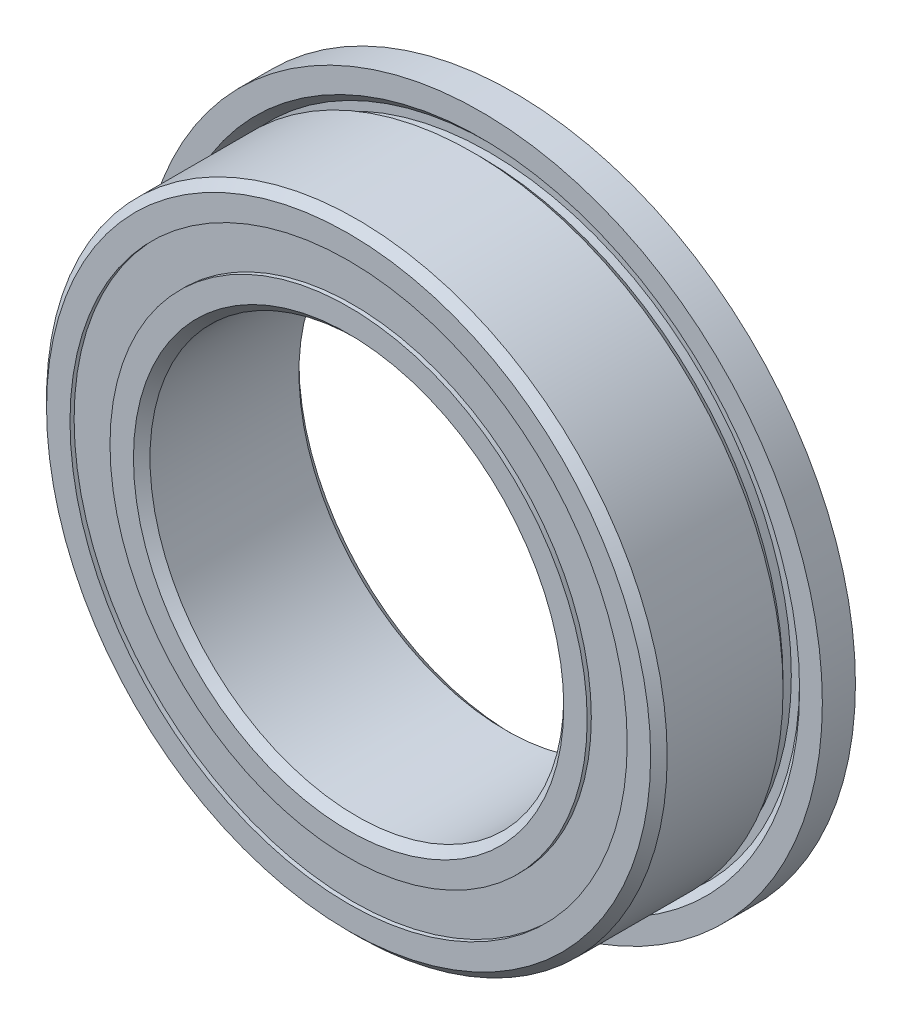
from build123d import *

# Parameters (mm, degrees)
SKETCH6_W         = 0.161172162
SKETCH6_H         = 0.483516484
CIRPATTERN1_COUNT = 11
SKETCH5_W         = 0.888114806
SKETCH5_H         = 0.967032968


with BuildPart() as part:
    # Sketch7 → Revolve7 (revolve)
    with BuildSketch(Plane(origin=(0, 0, 0), x_dir=(0, 0, -1), z_dir=(1, 0, 0))):
        with BuildLine():
            Line((2, 8.25), (1.2, 8.25))
            Line((1.2, 8.25), (1.2, 7.7))
            Line((1.2, 7.7), (1.4, 7.5))
            Line((1.4, 7.5), (1.4, 7.3))
            Line((1.4, 7.3), (1.2, 7.3))
            Line((1.2, 7.3), (1, 7.5))
            Line((1, 7.5), (-1.8, 7.5))
            Line((-1.8, 7.5), (-2, 7.3))
            Line((-2, 7.3), (-2, 6.733516484))
            Line((-2, 6.733516484), (-0.888888889, 6.733516484))
            ThreePointArc((-0.888888889, 6.733516484), (0, 7.261885194), (0.888888889, 6.733516484))
            Line((0.888888889, 6.733516484), (2, 6.733516484))
            Line((2, 6.733516484), (2, 7.3))
            Line((2, 7.3), (2, 8.25))
        make_face()
    revolve(axis=Axis((0, 0, 2), (0, 0, -1)))


with BuildPart() as body_2:
    # Sketch3 → Revolve3 (revolve)
    with BuildSketch(Plane(origin=(0, 0, 0), x_dir=(0, 0, -1), z_dir=(1, 0, 0))):
        with BuildLine():
            Line((-2, 5.766483516), (-0.888888889, 5.766483516))
            ThreePointArc((-0.888888889, 5.766483516), (0, 5.238114806), (0.888888889, 5.766483516))
            Line((0.888888889, 5.766483516), (2, 5.766483516))
            Line((2, 5.766483516), (2, 5.2))
            Line((2, 5.2), (1.8, 5))
            Line((1.8, 5), (-1.8, 5))
            Line((-1.8, 5), (-2, 5.2))
            Line((-2, 5.2), (-2, 5.766483516))
        make_face()
    revolve(axis=Axis((0, 0, 2), (0, 0, -1)))


with BuildPart() as body_3:
    # Sketch6 → Revolve6 (revolve)
    with BuildSketch(Plane(origin=(0, 0, 0), x_dir=(0, 0, -1), z_dir=(1, 0, 0))):
        with Locations((0, 6.25)):
            Rectangle(SKETCH6_W, SKETCH6_H)
    revolve(axis=Axis((0, 0, 2), (0, 0, -1)))


with BuildPart() as body_4:
    # Sketch4 → Revolve4 (revolve)
    with BuildSketch(Plane(origin=(0, 0, 0), x_dir=(0, 0, -1), z_dir=(1, 0, 0))):
        with BuildLine():
            Line((-1.011885194, 6.25), (1.011885194, 6.25))
            ThreePointArc((1.011885194, 6.25), (0, 7.261885194), (-1.011885194, 6.25))
        make_face()
    revolve(axis=Axis((0, 6.25, 1.011885194), (0, 0, -1)))


with BuildPart() as cirpattern1_1:
    # CirPattern1: pattern copy
    add(body_4.part.rotate(Axis((0, 0, -2), (0, 0, 1)), 1 * 360 / CIRPATTERN1_COUNT))


with BuildPart() as cirpattern1_2:
    # CirPattern1: pattern copy
    add(body_4.part.rotate(Axis((0, 0, -2), (0, 0, 1)), 2 * 360 / CIRPATTERN1_COUNT))


with BuildPart() as cirpattern1_3:
    # CirPattern1: pattern copy
    add(body_4.part.rotate(Axis((0, 0, -2), (0, 0, 1)), 3 * 360 / CIRPATTERN1_COUNT))


with BuildPart() as cirpattern1_4:
    # CirPattern1: pattern copy
    add(body_4.part.rotate(Axis((0, 0, -2), (0, 0, 1)), 4 * 360 / CIRPATTERN1_COUNT))


with BuildPart() as cirpattern1_5:
    # CirPattern1: pattern copy
    add(body_4.part.rotate(Axis((0, 0, -2), (0, 0, 1)), 5 * 360 / CIRPATTERN1_COUNT))


with BuildPart() as cirpattern1_6:
    # CirPattern1: pattern copy
    add(body_4.part.rotate(Axis((0, 0, -2), (0, 0, 1)), 6 * 360 / CIRPATTERN1_COUNT))


with BuildPart() as cirpattern1_7:
    # CirPattern1: pattern copy
    add(body_4.part.rotate(Axis((0, 0, -2), (0, 0, 1)), 7 * 360 / CIRPATTERN1_COUNT))


with BuildPart() as cirpattern1_8:
    # CirPattern1: pattern copy
    add(body_4.part.rotate(Axis((0, 0, -2), (0, 0, 1)), 8 * 360 / CIRPATTERN1_COUNT))


with BuildPart() as cirpattern1_9:
    # CirPattern1: pattern copy
    add(body_4.part.rotate(Axis((0, 0, -2), (0, 0, 1)), 9 * 360 / CIRPATTERN1_COUNT))


with BuildPart() as cirpattern1_10:
    # CirPattern1: pattern copy
    add(body_4.part.rotate(Axis((0, 0, -2), (0, 0, 1)), 10 * 360 / CIRPATTERN1_COUNT))


with BuildPart() as body_15:
    # Sketch5 → Revolve5 (revolve)
    with BuildSketch(Plane(origin=(0, 0, 0), x_dir=(0, 0, -1), z_dir=(1, 0, 0))):
        with Locations((-1.455942597, 6.25)):
            Rectangle(SKETCH5_W, SKETCH5_H)
        with Locations((1.455942597, 6.25)):
            Rectangle(SKETCH5_W, SKETCH5_H)
    revolve(axis=Axis((0, 0, 2), (0, 0, -1)))


solid = Compound([part.part, body_2.part, body_3.part, body_4.part, cirpattern1_1.part, cirpattern1_2.part, cirpattern1_3.part, cirpattern1_4.part, cirpattern1_5.part, cirpattern1_6.part, cirpattern1_7.part, cirpattern1_8.part, cirpattern1_9.part, cirpattern1_10.part, body_15.part])
